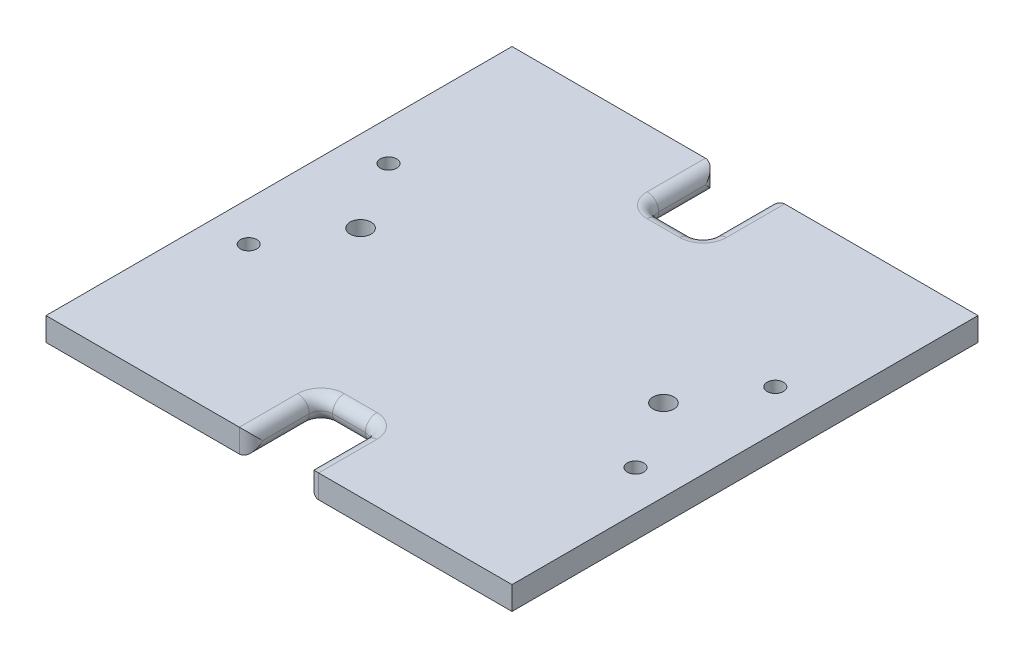
from build123d import *

# Parameters (mm, degrees)
BOSS_EXTRUDE1_DEPTH            = 100
CUT_EXTRUDE3_DEPTH             = 202.556443707
CUT_EXTRUDE3_DEPTH_BACK        = 202.556443707
SKETCH4_4_R                    = 9.85
CUT_EXTRUDE4_DEPTH             = 3
CUT_EXTRUDE5_START             = 103
SKETCH4_6_R                    = 9.85
CUT_EXTRUDE5_DEPTH             = 103
CUT_EXTRUDE6_REACH             = 206.206
SKETCH5_R                      = 2.25
CUT_EXTRUDE6_DIRECTION_2_DEPTH = 205.205778567
CUT_EXTRUDE7_REACH             = 201.841
SKETCH6_R                      = 2.25
SKETCH7_W                      = 12
SKETCH7_H                      = 15
CUT_EXTRUDE8_DEPTH             = 197.242821038
FILLET3_R                      = 2.5
FILLET4_R                      = 2.5
FILLET6_R                      = 5
CUT_EXTRUDE9_DEPTH             = 197.242821038
CUT_EXTRUDE9_DEPTH_BACK        = 197.242821038
SKETCH8_W                      = 5
SKETCH8_H                      = 100
CUT_EXTRUDE10_REACH            = 136.228
SKETCH11_R                     = 1.75


with BuildPart() as part:
    # Sketch1 → Boss-Extrude1 (new body)
    with BuildSketch(Plane.XY):
        Polygon((-10.600610125, 140), (-15.600610125, 140), (-15.600610125, -5), (94.399389875, -5), (94.399389875, 140), (89.399389875, 140), (89.399389875, 0), (-10.600610125, 0), align=None)
    extrude(amount=-BOSS_EXTRUDE1_DEPTH)

    # Sketch4 → Cut-Extrude3 (cut, two sides: drawn at the far end of the back side and taken through both)
    with BuildSketch(Plane.ZY.offset(-89.399389875).offset(-CUT_EXTRUDE3_DEPTH_BACK)):
        with BuildLine():
            ThreePointArc((-89.05, 45), (-82.05, 38), (-75.05, 45))
            Line((-75.05, 45), (-82.05, 45))
            Line((-82.05, 45), (-89.05, 45))
        make_face()
        with BuildLine():
            Line((-82.05, 45), (-75.05, 45))
            ThreePointArc((-75.05, 45), (-82.05, 52), (-89.05, 45))
            Line((-89.05, 45), (-82.05, 45))
        make_face()
        with BuildLine():
            ThreePointArc((-57, 45), (-50, 38), (-43, 45))
            Line((-43, 45), (-50, 45))
            Line((-50, 45), (-57, 45))
        make_face()
        with BuildLine():
            Line((-50, 45), (-43, 45))
            ThreePointArc((-43, 45), (-50, 52), (-57, 45))
            Line((-57, 45), (-50, 45))
        make_face()
        with BuildLine():
            ThreePointArc((-24.95, 45), (-17.95, 38), (-10.95, 45))
            Line((-10.95, 45), (-17.95, 45))
            Line((-17.95, 45), (-24.95, 45))
        make_face()
        with BuildLine():
            Line((-17.95, 45), (-10.95, 45))
            ThreePointArc((-10.95, 45), (-17.95, 52), (-24.95, 45))
            Line((-24.95, 45), (-17.95, 45))
        make_face()
    extrude(amount=CUT_EXTRUDE3_DEPTH + CUT_EXTRUDE3_DEPTH_BACK, mode=Mode.SUBTRACT)

    # Sketch4<4> → Cut-Extrude4 (cut)
    with BuildSketch(Plane.ZY.offset(-89.399389875)):
        with Locations((-50, 45)):
            Circle(SKETCH4_4_R)
        with Locations((-82.05, 45)):
            Circle(SKETCH4_4_R)
        with Locations((-17.95, 45)):
            Circle(SKETCH4_4_R)
    extrude(amount=-CUT_EXTRUDE4_DEPTH, mode=Mode.SUBTRACT)

    # Sketch4<6> → Cut-Extrude5 (cut)
    with BuildSketch(Plane.ZY.offset(-89.399389875).offset(CUT_EXTRUDE5_START)):
        with Locations((-50, 45)):
            Circle(SKETCH4_6_R)
        with Locations((-82.05, 45)):
            Circle(SKETCH4_6_R)
        with Locations((-17.95, 45)):
            Circle(SKETCH4_6_R)
    extrude(amount=-CUT_EXTRUDE5_DEPTH, mode=Mode.SUBTRACT)

    # Sketch5 → Cut-Extrude6 (cut, up to next)
    with BuildSketch(Plane.ZY.offset(15.600610125), mode=Mode.PRIVATE) as cut_extrude6_sk1:
        with Locations(Location((-78.75, 119.5, 0), (0, 0, 90))):
            Circle(SKETCH5_R)
    cut_extrude6_tool1 = extrude(cut_extrude6_sk1.sketch, amount=-CUT_EXTRUDE6_REACH, mode=Mode.PRIVATE) & part.part
    # Sketch5 → Cut-Extrude6 (cut, up to next)
    with BuildSketch(Plane.ZY.offset(15.600610125), mode=Mode.PRIVATE) as cut_extrude6_sk2:
        with Locations(Location((-21.25, 119.5, 0), (0, 0, 90))):
            Circle(SKETCH5_R)
    cut_extrude6_tool2 = extrude(cut_extrude6_sk2.sketch, amount=-CUT_EXTRUDE6_REACH, mode=Mode.PRIVATE) & part.part
    add(cut_extrude6_tool1.solids().sort_by_distance((-15.60061, 119.5, -78.75))[0], mode=Mode.SUBTRACT)
    add(cut_extrude6_tool2.solids().sort_by_distance((-15.60061, 119.5, -21.25))[0], mode=Mode.SUBTRACT)

    # Sketch5 → Cut-Extrude6 direction 2 (cut)
    with BuildSketch(Plane.ZY.offset(15.600610125)):
        with Locations(Location((-78.75, 119.5, 0), (0, 0, 90))):
            Circle(SKETCH5_R)
        with Locations(Location((-21.25, 119.5, 0), (0, 0, 90))):
            Circle(SKETCH5_R)
    extrude(amount=CUT_EXTRUDE6_DIRECTION_2_DEPTH, mode=Mode.SUBTRACT)

    # Sketch6 → Cut-Extrude7 (cut, up to next)
    with BuildSketch(Plane.XZ.offset(5), mode=Mode.PRIVATE) as cut_extrude7_sk1:
        with Locations(Location((71.899389875, -50, 0), (0, 0, 270))):
            Circle(SKETCH6_R)
    cut_extrude7_tool1 = extrude(cut_extrude7_sk1.sketch, amount=-CUT_EXTRUDE7_REACH, mode=Mode.PRIVATE) & part.part
    # Sketch6 → Cut-Extrude7 (cut, up to next)
    with BuildSketch(Plane.XZ.offset(5), mode=Mode.PRIVATE) as cut_extrude7_sk2:
        with Locations(Location((6.899389875, -50, 0), (0, 0, 270))):
            Circle(SKETCH6_R)
    cut_extrude7_tool2 = extrude(cut_extrude7_sk2.sketch, amount=-CUT_EXTRUDE7_REACH, mode=Mode.PRIVATE) & part.part
    add(cut_extrude7_tool1.solids().sort_by_distance((71.89939, -5, -50))[0], mode=Mode.SUBTRACT)
    add(cut_extrude7_tool2.solids().sort_by_distance((6.89939, -5, -50))[0], mode=Mode.SUBTRACT)

    # Sketch7 → Cut-Extrude8 (cut, through all)
    with BuildSketch(Plane(origin=(0, 0, 0), x_dir=(1, 0, 0), z_dir=(0, 1, 0))):
        Polygon((45.399389875, 100), (39.399389875, 100), (33.399389875, 100), (33.399389875, 85), (45.399389875, 85), align=None)
        with Locations((39.399389875, 7.5)):
            Rectangle(SKETCH7_W, SKETCH7_H)
    extrude(amount=-CUT_EXTRUDE8_DEPTH, mode=Mode.SUBTRACT)

    # Fillet3
    fillet3_edges = [part.edges().sort_by_distance(p)[0] for p in [
        (33.399389875, 0, -7.5),
        (33.399389875, -2.5, 0),
        (39.399389875, 0, -15),
        (33.399389875, -2.5, -15),
        (45.399389875, -5, -7.5),
        (45.399389875, -2.5, -15),
        (45.399389875, -2.5, 0),
        (33.399389875, -5, -7.5),
        (39.399389875, -5, -15),
        (45.399389875, 0, -7.5),
    ]]
    fillet(fillet3_edges, radius=FILLET3_R - 0.0001)  # a hair under: the kernel refuses the full size

    # Fillet4
    fillet4_edges = [part.edges().sort_by_distance(p)[0] for p in [
        (45.399389875, 0, -92.5),
        (45.399389875, -2.5, -100),
        (39.399389875, -5, -85),
        (45.399389875, -2.5, -85),
        (33.399389875, -5, -92.5),
        (33.399389875, -2.5, -85),
        (33.399389875, -2.5, -100),
        (45.399389875, -5, -92.5),
        (33.399389875, 0, -92.5),
        (39.399389875, 0, -85),
    ]]
    fillet(fillet4_edges, radius=FILLET4_R - 0.0001)  # a hair under: the kernel refuses the full size

    # Fillet6
    fillet6_edges = [part.edges().sort_by_distance(p)[0] for p in [
        (91.899389875, 140, -100),
        (-13.100610125, 140, -100),
        (-13.100610125, 140, 0),
        (91.899389875, 140, 0),
    ]]
    fillet(fillet6_edges, radius=FILLET6_R)

    # Sketch8 → Cut-Extrude9 (cut, two sides: drawn at the far end of the back side and taken through both)
    with BuildSketch(Plane(origin=(0, 0, 0), x_dir=(1, 0, 0), z_dir=(0, 1, 0)).offset(-CUT_EXTRUDE9_DEPTH_BACK)):
        with Locations((-13.100610125, 50)):
            Rectangle(SKETCH8_W, SKETCH8_H)
        with Locations((91.899389875, 50)):
            Rectangle(SKETCH8_W, SKETCH8_H)
    extrude(amount=CUT_EXTRUDE9_DEPTH + CUT_EXTRUDE9_DEPTH_BACK, mode=Mode.SUBTRACT)

    # Sketch11 → Cut-Extrude10 (cut, up to next)
    with BuildSketch(Plane(origin=(0, 0, 0), x_dir=(1, 0, 0), z_dir=(0, 1, 0)), mode=Mode.PRIVATE) as cut_extrude10_sk1:
        with Locations(Location((80.899389875, 65, 0), (0, 0, 270))):
            Circle(SKETCH11_R)
    cut_extrude10_tool1 = extrude(cut_extrude10_sk1.sketch, amount=-CUT_EXTRUDE10_REACH, mode=Mode.PRIVATE) & part.part
    # Sketch11 → Cut-Extrude10 (cut, up to next)
    with BuildSketch(Plane(origin=(0, 0, 0), x_dir=(1, 0, 0), z_dir=(0, 1, 0)), mode=Mode.PRIVATE) as cut_extrude10_sk2:
        with Locations(Location((80.899389875, 35, 0), (0, 0, 270))):
            Circle(SKETCH11_R)
    cut_extrude10_tool2 = extrude(cut_extrude10_sk2.sketch, amount=-CUT_EXTRUDE10_REACH, mode=Mode.PRIVATE) & part.part
    # Sketch11 → Cut-Extrude10 (cut, up to next)
    with BuildSketch(Plane(origin=(0, 0, 0), x_dir=(1, 0, 0), z_dir=(0, 1, 0)), mode=Mode.PRIVATE) as cut_extrude10_sk3:
        with Locations(Location((-2.100610125, 35, 0), (0, 0, 270))):
            Circle(SKETCH11_R)
    cut_extrude10_tool3 = extrude(cut_extrude10_sk3.sketch, amount=-CUT_EXTRUDE10_REACH, mode=Mode.PRIVATE) & part.part
    # Sketch11 → Cut-Extrude10 (cut, up to next)
    with BuildSketch(Plane(origin=(0, 0, 0), x_dir=(1, 0, 0), z_dir=(0, 1, 0)), mode=Mode.PRIVATE) as cut_extrude10_sk4:
        with Locations(Location((-2.100610125, 65, 0), (0, 0, 270))):
            Circle(SKETCH11_R)
    cut_extrude10_tool4 = extrude(cut_extrude10_sk4.sketch, amount=-CUT_EXTRUDE10_REACH, mode=Mode.PRIVATE) & part.part
    add(cut_extrude10_tool1.solids().sort_by_distance((80.89939, 0, -65))[0], mode=Mode.SUBTRACT)
    add(cut_extrude10_tool2.solids().sort_by_distance((80.89939, 0, -35))[0], mode=Mode.SUBTRACT)
    add(cut_extrude10_tool3.solids().sort_by_distance((-2.10061, 0, -35))[0], mode=Mode.SUBTRACT)
    add(cut_extrude10_tool4.solids().sort_by_distance((-2.10061, 0, -65))[0], mode=Mode.SUBTRACT)


solid = part.part
